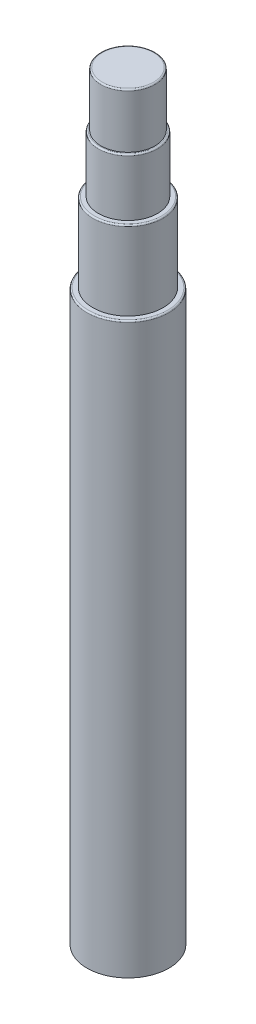
from build123d import *

# Parameters (mm, degrees)
SKETCH1_R           = 28.575
BOSS_EXTRUDE1_DEPTH = 397
SKETCH2_R           = 24.5
BOSS_EXTRUDE2_DEPTH = 55
SKETCH3_R           = 20.64
BOSS_EXTRUDE3_DEPTH = 40
SKETCH4_R           = 18.9
BOSS_EXTRUDE4_DEPTH = 38
FILLET1_R           = 1


with BuildPart() as part:
    # Sketch1 → Boss-Extrude1 (new body)
    with BuildSketch(Plane(origin=(0, 0, 0), x_dir=(1, 0, 0), z_dir=(0, 1, 0))):
        Circle(SKETCH1_R)
    extrude(amount=BOSS_EXTRUDE1_DEPTH)

    # Sketch2 → Boss-Extrude2 (add)
    with BuildSketch(Plane(origin=(0, 397, 0), x_dir=(1, 0, 0), z_dir=(0, 1, 0))):
        Circle(SKETCH2_R)
    extrude(amount=BOSS_EXTRUDE2_DEPTH)

    # Sketch3 → Boss-Extrude3 (add)
    with BuildSketch(Plane(origin=(0, 452, 0), x_dir=(1, 0, 0), z_dir=(0, 1, 0))):
        Circle(SKETCH3_R)
    extrude(amount=BOSS_EXTRUDE3_DEPTH)

    # Sketch4 → Boss-Extrude4 (add)
    with BuildSketch(Plane(origin=(0, 492, 0), x_dir=(1, 0, 0), z_dir=(0, 1, 0))):
        Circle(SKETCH4_R)
    extrude(amount=BOSS_EXTRUDE4_DEPTH)

    # Fillet1
    fillet1_edges = [part.edges().sort_by_distance(p)[0] for p in [
        (-28.575, 397, 0),
        (-24.5, 452, 0),
        (-20.64, 492, 0),
        (-18.9, 530, 0),
    ]]
    fillet(fillet1_edges, radius=FILLET1_R)


solid = part.part
